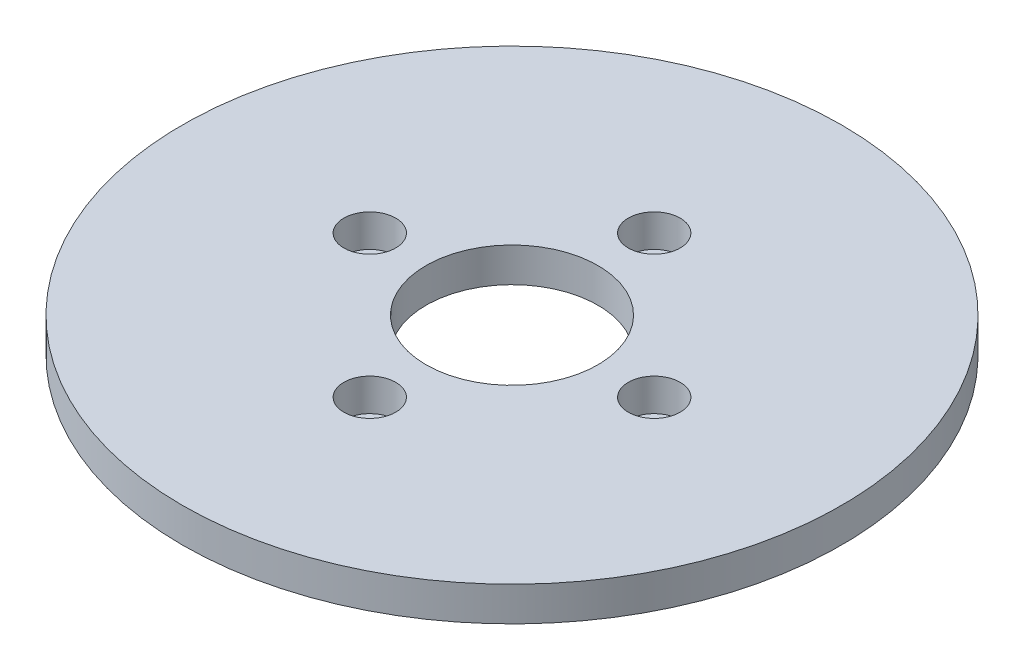
from build123d import *

# Parameters (mm, degrees)
SKETCH1_R           = 57.5
BOSS_EXTRUDE1_DEPTH = 6
SKETCH2_R           = 15
CUT_EXTRUDE1_DEPTH  = 82.538334543
SKETCH3_R           = 4.526330216
CUT_EXTRUDE2_DEPTH  = 5.677185303
CIRPATTERN1_COUNT   = 4


with BuildPart() as part:
    # Sketch1 → Boss-Extrude1 (new body)
    with BuildSketch(Plane(origin=(0, 0, 0), x_dir=(1, 0, 0), z_dir=(0, 1, 0))):
        Circle(SKETCH1_R)
    extrude(amount=BOSS_EXTRUDE1_DEPTH)

    # Sketch2 → Cut-Extrude1 (cut, through all)
    with BuildSketch(Plane(origin=(0, 0, 0), x_dir=(1, 0, 0), z_dir=(0, 1, 0))):
        Circle(SKETCH2_R)
    extrude(amount=CUT_EXTRUDE1_DEPTH, mode=Mode.SUBTRACT)

    # Sketch3 → Cut-Extrude2 (cut)
    with BuildSketch(Plane(origin=(0, 6, 0), x_dir=(1, 0, 0), z_dir=(0, 1, 0))):
        with Locations((-24.813403353, 0)):
            Circle(SKETCH3_R)
    cut_extrude2 = extrude(amount=-CUT_EXTRUDE2_DEPTH, mode=Mode.SUBTRACT)

    # CirPattern1: Cut-Extrude2 ×4 about axis
    cirpattern1_axis = Axis((0, 0, 0), (0, 1, 0))
    for i in range(1, CIRPATTERN1_COUNT):
        add(cut_extrude2.rotate(cirpattern1_axis, i * 360 / CIRPATTERN1_COUNT), mode=Mode.SUBTRACT)


solid = part.part
